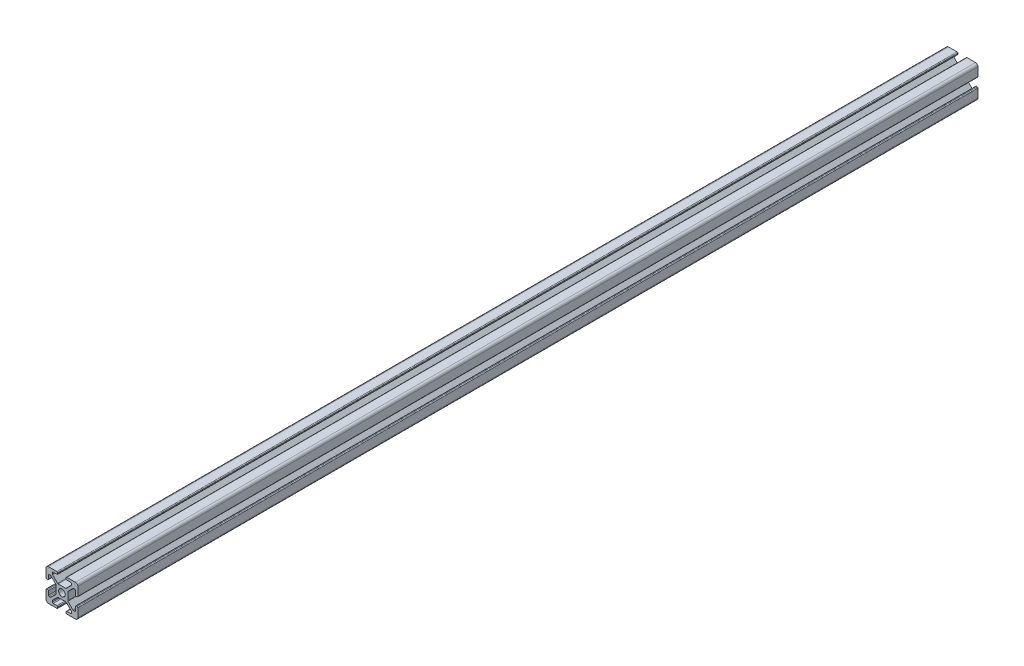
from build123d import *

# Parameters (mm, degrees)
SKETCH1_W               = 20
SKETCH1_H               = 20
BOSS_EXTRUDE1_DEPTH     = 565
CUT_EXTRUDE1_DEPTH      = 566.176963437
FILLET1_R               = 0.5
CIRPATTERN1_START       = -565
CIRPATTERN1_DEPTH       = 565
FILLET2_R               = 1.5
SKETCH3_R               = 2.095
CUT_EXTRUDE2_DEPTH      = 566.176963437
FILLET3_R               = 0.5
SKETCH4_R               = 2.5
CUT_EXTRUDE3_DEPTH      = 566.253446717
CIRPATTERN2_COUNT       = 2
CIRPATTERN2_ANGLE       = 90
CUT_EXTRUDE4_DEPTH      = 566.253446817
CUT_EXTRUDE4_DEPTH_BACK = 566.253446817
SKETCH5_R               = 2.5


# Read off the part's stored shape, not the designer's step: CirPattern1
with BuildPart() as part:
    # Sketch1 → Boss-Extrude1 (new body)
    with BuildSketch(Plane.XY):
        Rectangle(SKETCH1_W, SKETCH1_H)
    extrude(amount=-BOSS_EXTRUDE1_DEPTH)

    # Sketch2 → Cut-Extrude1 (cut, through all)
    with BuildSketch(Plane.XY):
        Polygon((0, 10), (-2.63, 10), (-2.63, 8.5), (-5.995, 8.5), (-5.995, 7.055660172), (-2.594339828, 3.655), (2.594339828, 3.655), (5.995, 7.055660172), (5.995, 8.5), (2.63, 8.5), (2.63, 10), align=None)
    extrude(amount=-CUT_EXTRUDE1_DEPTH, mode=Mode.SUBTRACT)

    # Fillet1
    fillet1_edges = [part.edges().sort_by_distance(p)[0] for p in [
        (2.63, 10, -282.5),
        (2.63, 8.5, -282.5),
        (5.995, 8.5, -282.5),
        (5.995, 7.055660172, -282.5),
        (2.594339828, 3.655, -282.5),
        (-2.594339828, 3.655, -282.5),
        (-5.995, 7.055660172, -282.5),
        (-5.995, 8.5, -282.5),
        (-2.63, 8.5, -282.5),
        (-2.63, 10, -282.5),
    ]]
    fillet(fillet1_edges, radius=FILLET1_R)

    # CirPattern1 outline → CirPattern1 (cut)
    with BuildSketch(Plane.XY.offset(CIRPATTERN1_START)):
        with BuildLine():
            Line((-2.63, -10), (2.63, -10))
            Line((2.63, -10), (2.63, -9))
            ThreePointArc((2.63, -9), (2.776446609, -8.646446609), (3.13, -8.5))
            Line((3.13, -8.5), (5.495, -8.5))
            ThreePointArc((5.495, -8.5), (5.848553391, -8.353553391), (5.995, -8))
            Line((5.995, -8), (5.995, -7.262766953))
            ThreePointArc((5.995, -7.262766953), (5.956939766, -7.071425237), (5.848553391, -6.909213562))
            Line((5.848553391, -6.909213562), (2.740786438, -3.801446609))
            ThreePointArc((2.740786438, -3.801446609), (2.578574763, -3.693060234), (2.387233047, -3.655))
            Line((2.387233047, -3.655), (-2.387233047, -3.655))
            ThreePointArc((-2.387233047, -3.655), (-2.578574763, -3.693060234), (-2.740786438, -3.801446609))
            Line((-2.740786438, -3.801446609), (-5.848553391, -6.909213562))
            ThreePointArc((-5.848553391, -6.909213562), (-5.956939766, -7.071425237), (-5.995, -7.262766953))
            Line((-5.995, -7.262766953), (-5.995, -8))
            ThreePointArc((-5.995, -8), (-5.848553391, -8.353553391), (-5.495, -8.5))
            Line((-5.495, -8.5), (-3.13, -8.5))
            ThreePointArc((-3.13, -8.5), (-2.776446609, -8.646446609), (-2.63, -9))
            Line((-2.63, -9), (-2.63, -10))
        make_face()
        with BuildLine():
            Line((-10, 2.63), (-10, -2.63))
            Line((-10, -2.63), (-9, -2.63))
            ThreePointArc((-9, -2.63), (-8.646446609, -2.776446609), (-8.5, -3.13))
            Line((-8.5, -3.13), (-8.5, -5.495))
            ThreePointArc((-8.5, -5.495), (-8.353553391, -5.848553391), (-8, -5.995))
            Line((-8, -5.995), (-7.262766953, -5.995))
            ThreePointArc((-7.262766953, -5.995), (-7.071425237, -5.956939766), (-6.909213562, -5.848553391))
            Line((-6.909213562, -5.848553391), (-3.801446609, -2.740786438))
            ThreePointArc((-3.801446609, -2.740786438), (-3.693060234, -2.578574763), (-3.655, -2.387233047))
            Line((-3.655, -2.387233047), (-3.655, 2.387233047))
            ThreePointArc((-3.655, 2.387233047), (-3.693060234, 2.578574763), (-3.801446609, 2.740786438))
            Line((-3.801446609, 2.740786438), (-6.909213562, 5.848553391))
            ThreePointArc((-6.909213562, 5.848553391), (-7.071425237, 5.956939766), (-7.262766953, 5.995))
            Line((-7.262766953, 5.995), (-8, 5.995))
            ThreePointArc((-8, 5.995), (-8.353553391, 5.848553391), (-8.5, 5.495))
            Line((-8.5, 5.495), (-8.5, 3.13))
            ThreePointArc((-8.5, 3.13), (-8.646446609, 2.776446609), (-9, 2.63))
            Line((-9, 2.63), (-10, 2.63))
        make_face()
        with BuildLine():
            Line((9, -2.63), (10, -2.63))
            Line((10, -2.63), (10, 2.63))
            Line((10, 2.63), (9, 2.63))
            ThreePointArc((9, 2.63), (8.646446609, 2.776446609), (8.5, 3.13))
            Line((8.5, 3.13), (8.5, 5.495))
            ThreePointArc((8.5, 5.495), (8.353553391, 5.848553391), (8, 5.995))
            Line((8, 5.995), (7.262766953, 5.995))
            ThreePointArc((7.262766953, 5.995), (7.071425237, 5.956939766), (6.909213562, 5.848553391))
            Line((6.909213562, 5.848553391), (3.801446609, 2.740786438))
            ThreePointArc((3.801446609, 2.740786438), (3.693060234, 2.578574763), (3.655, 2.387233047))
            Line((3.655, 2.387233047), (3.655, -2.387233047))
            ThreePointArc((3.655, -2.387233047), (3.693060234, -2.578574763), (3.801446609, -2.740786438))
            Line((3.801446609, -2.740786438), (6.909213562, -5.848553391))
            ThreePointArc((6.909213562, -5.848553391), (7.071425237, -5.956939766), (7.262766953, -5.995))
            Line((7.262766953, -5.995), (8, -5.995))
            ThreePointArc((8, -5.995), (8.353553391, -5.848553391), (8.5, -5.495))
            Line((8.5, -5.495), (8.5, -3.13))
            ThreePointArc((8.5, -3.13), (8.646446609, -2.776446609), (9, -2.63))
        make_face()
    extrude(amount=CIRPATTERN1_DEPTH, mode=Mode.SUBTRACT)

    # Fillet2
    fillet2_edges = [part.edges().sort_by_distance(p)[0] for p in [
        (10, -10, -282.5),
        (-10, -10, -282.5),
        (-10, 10, -282.5),
        (10, 10, -282.5),
    ]]
    fillet(fillet2_edges, radius=FILLET2_R)

    # Sketch3 → Cut-Extrude2 (cut, through all)
    with BuildSketch(Plane.XY):
        Circle(SKETCH3_R)
    extrude(amount=-CUT_EXTRUDE2_DEPTH, mode=Mode.SUBTRACT)

    # Fillet3
    fillet3_edges = [part.edges().sort_by_distance(p)[0] for p in [
        (-10, 2.63, -282.5),
        (-10, -2.63, -282.5),
        (-2.63, -10, -282.5),
        (2.63, -10, -282.5),
        (10, -2.63, -282.5),
        (10, 2.63, -282.5),
    ]]
    fillet(fillet3_edges, radius=FILLET3_R)

    # Sketch4 → Cut-Extrude3 (cut, symmetric)
    with BuildSketch(Plane.ZY.offset(3.655)):
        with Locations(Location((-555, 0, 0), (0, 0, 287.274468256))):
            Circle(SKETCH4_R)
        with Locations(Location((-110, 0, 0), (0, 0, 252.725531744))):
            Circle(SKETCH4_R)
    cut_extrude3 = extrude(amount=CUT_EXTRUDE3_DEPTH, both=True, mode=Mode.SUBTRACT)

    # CirPattern2: Cut-Extrude3 ×2 about axis
    cirpattern2_axis = Axis((0, 0, -379.05), (0, 0, 1))
    for i in range(1, CIRPATTERN2_COUNT):
        add(cut_extrude3.rotate(cirpattern2_axis, i * CIRPATTERN2_ANGLE / (CIRPATTERN2_COUNT - 1)), mode=Mode.SUBTRACT)

    # Sketch5 → Cut-Extrude4 (cut, two sides: drawn at the far end of the back side and taken through both)
    with BuildSketch(Plane.ZY.offset(3.655).offset(-CUT_EXTRUDE4_DEPTH_BACK)):
        with Locations(Location((-470, 0, 0), (0, 0, 252.725531744))):
            Circle(SKETCH5_R)
    extrude(amount=CUT_EXTRUDE4_DEPTH + CUT_EXTRUDE4_DEPTH_BACK, mode=Mode.SUBTRACT)


solid = part.part
